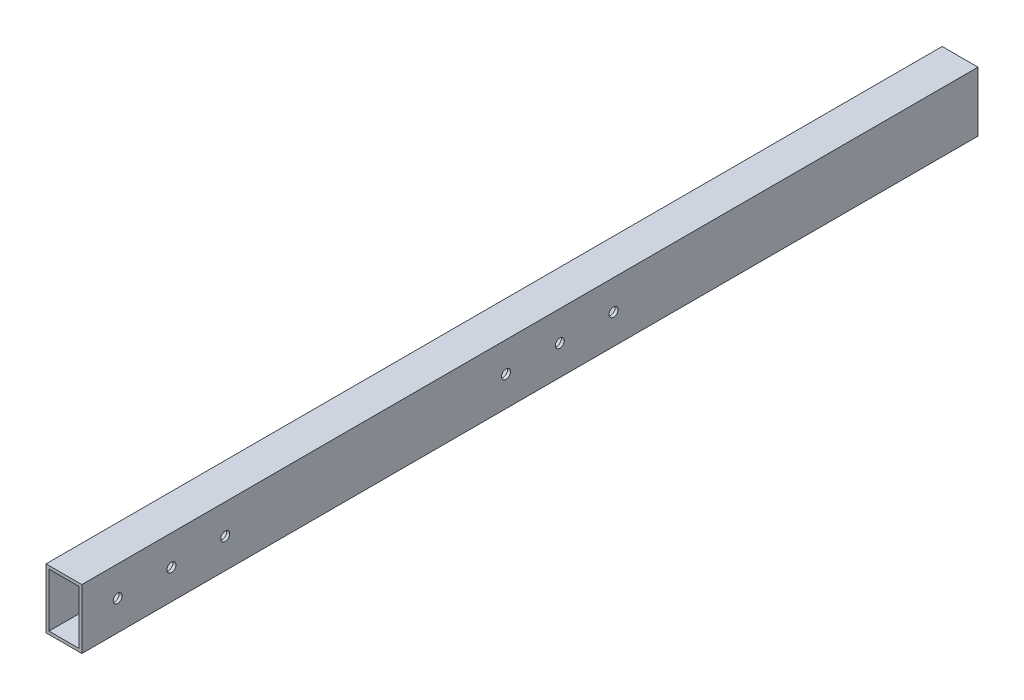
from build123d import *

# Parameters (mm, degrees)
SKETCH1_W           = 12
SKETCH1_H           = 20
SKETCH1_W_2         = 10
SKETCH1_H_2         = 18
BOSS_EXTRUDE1_DEPTH = 300
SKETCH2_R           = 1.5
CUT_EXTRUDE1_DEPTH  = 200


with BuildPart() as part:
    # Sketch1 → Boss-Extrude1 (new body)
    with BuildSketch(Plane.XY):
        Rectangle(SKETCH1_W, SKETCH1_H)
        Rectangle(SKETCH1_W_2, SKETCH1_H_2, mode=Mode.SUBTRACT)
    extrude(amount=BOSS_EXTRUDE1_DEPTH)

    # Sketch2 → Cut-Extrude1 (cut)
    with BuildSketch(Plane(origin=(6, 0, 0), x_dir=(0, 0, -1), z_dir=(1, 0, 0))):
        with Locations((-140, 0)):
            Circle(SKETCH2_R)
        with Locations((-122, 0)):
            Circle(SKETCH2_R)
        with Locations((-158, 0)):
            Circle(SKETCH2_R)
        with Locations((-270, 0)):
            Circle(SKETCH2_R)
        with Locations((-288, 0)):
            Circle(SKETCH2_R)
        with Locations((-252, 0)):
            Circle(SKETCH2_R)
    extrude(amount=-CUT_EXTRUDE1_DEPTH, mode=Mode.SUBTRACT)


solid = part.part
